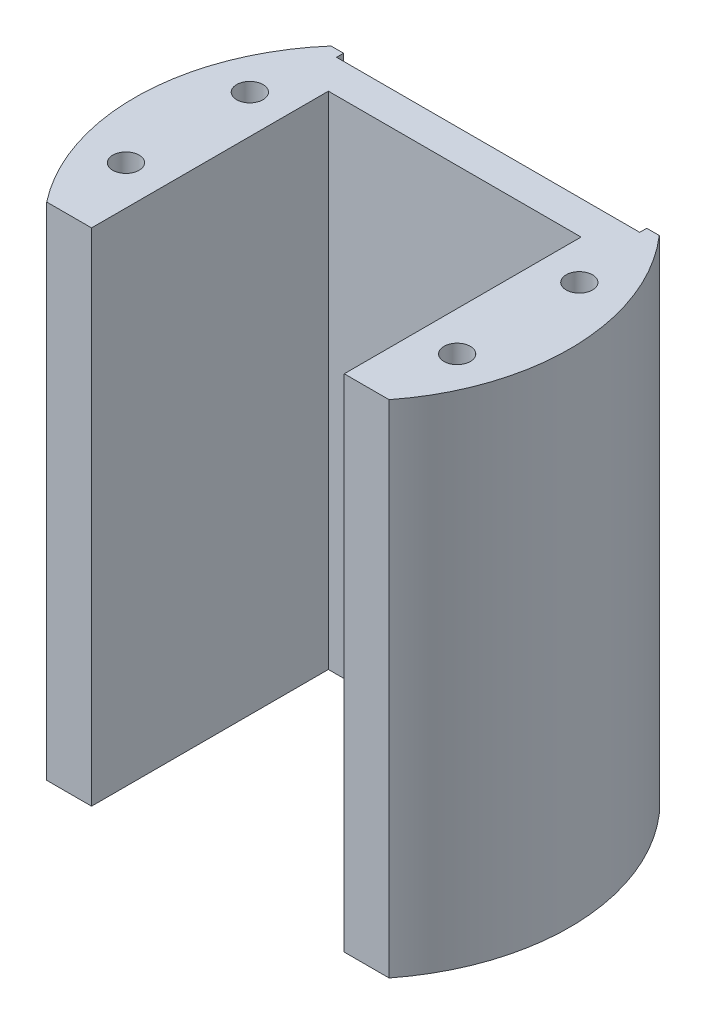
from build123d import *

# Parameters (mm, degrees)
SKETCH1_R           = 3
BOSS_EXTRUDE2_DEPTH = 114


with BuildPart() as part:
    # Sketch1 → Boss-Extrude2 (new body)
    with BuildSketch(Plane(origin=(0, 0, 0), x_dir=(1, 0, 0), z_dir=(0, 1, 0))):
        with BuildLine():
            Line((-38.960872846, -30.582205399), (-28.757656934, -30.582205399))
            Line((-28.757656934, -30.582205399), (-28.757656934, 23.321119009))
            Line((-28.757656934, 23.321119009), (28.757656934, 23.321119009))
            Line((28.757656934, 23.321119009), (28.757656934, -30.582205399))
            Line((28.757656934, -30.582205399), (38.960872846, -30.582205399))
            ThreePointArc((38.960872846, -30.582205399), (46.813208243, -16.178517669), (49.53, 0))
            ThreePointArc((49.53, 0), (46.385327287, 17.367277059), (37.350621343, 32.529248152))
            Line((37.350621343, 32.529248152), (34.5, 32.529248152))
            Line((34.5, 32.529248152), (34.5, 30.929248152))
            Line((34.5, 30.929248152), (-34.5, 30.929248152))
            Line((-34.5, 30.929248152), (-34.5, 32.529248152))
            Line((-34.5, 32.529248152), (-37.350621343, 32.529248152))
            ThreePointArc((-37.350621343, 32.529248152), (-49.51388622, 1.263317595), (-38.960872846, -30.582205399))
        make_face()
        with Locations((-37.690112611, -13.812642955)):
            Circle(SKETCH1_R, mode=Mode.SUBTRACT)
        with Locations((37.690112611, -13.812642955)):
            Circle(SKETCH1_R, mode=Mode.SUBTRACT)
        with Locations((-37.5, 14.187357045)):
            Circle(SKETCH1_R, mode=Mode.SUBTRACT)
        with Locations((37.5, 14.187357045)):
            Circle(SKETCH1_R, mode=Mode.SUBTRACT)
    extrude(amount=BOSS_EXTRUDE2_DEPTH)


solid = part.part
